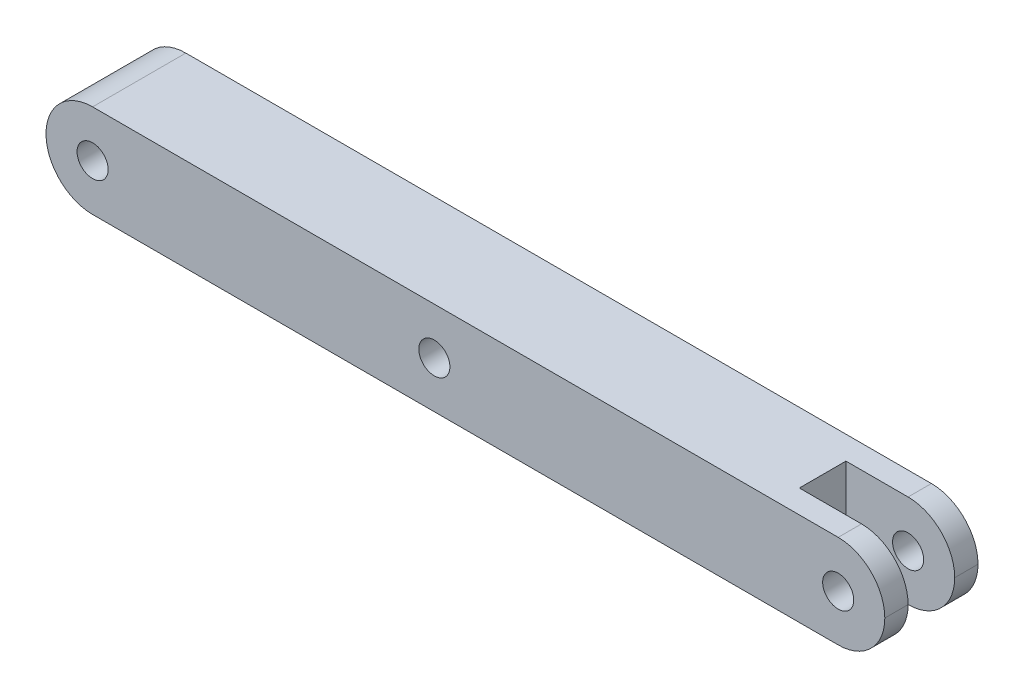
from build123d import *

# Parameters (mm, degrees)
SKETCH1_W               = 270
SKETCH1_H               = 30
BOSS_EXTRUDE1_DEPTH     = 15
CUT_EXTRUDE1_REACH      = 274.075
SKETCH2_W               = 35
SKETCH2_H               = 15
CUT_EXTRUDE2_DEPTH      = 274.313007374
CUT_EXTRUDE2_DEPTH_BACK = 274.313007374
SKETCH3_R               = 5
FILLET3_R               = 15


with BuildPart() as part:
    # Sketch1 → Boss-Extrude1 (new, symmetric)
    with BuildSketch(Plane.XY):
        with Locations((135, 15)):
            Rectangle(SKETCH1_W, SKETCH1_H)
    extrude(amount=BOSS_EXTRUDE1_DEPTH, both=True)

    # Sketch2 → Cut-Extrude1 (cut, up to next)
    with BuildSketch(Plane(origin=(0, 30, 0), x_dir=(1, 0, 0), z_dir=(0, 1, 0)), mode=Mode.PRIVATE) as cut_extrude1_sk1:
        with Locations((252.5, 0)):
            Rectangle(SKETCH2_W, SKETCH2_H)
    cut_extrude1_tool1 = extrude(cut_extrude1_sk1.sketch, amount=-CUT_EXTRUDE1_REACH, mode=Mode.PRIVATE) & part.part
    add(cut_extrude1_tool1.solids().sort_by_distance((252.5, 30, 0))[0], mode=Mode.SUBTRACT)

    # Sketch3 → Cut-Extrude2 (cut, two sides: drawn at the far end of the back side and taken through both)
    with BuildSketch(Plane.XY.offset(15).offset(-CUT_EXTRUDE2_DEPTH_BACK)):
        with Locations((15, 15)):
            Circle(SKETCH3_R)
        with Locations((255, 15)):
            Circle(SKETCH3_R)
        with Locations((125, 15)):
            Circle(SKETCH3_R)
    extrude(amount=CUT_EXTRUDE2_DEPTH + CUT_EXTRUDE2_DEPTH_BACK, mode=Mode.SUBTRACT)

    # Fillet3
    fillet3_edges = [part.edges().sort_by_distance(p)[0] for p in [
        (270, 0, -11.25),
        (270, 30, -11.25),
        (270, 0, 11.25),
        (270, 30, 11.25),
        (0, 0, 0),
        (0, 30, 0),
    ]]
    fillet(fillet3_edges, radius=FILLET3_R - 0.0001)  # a hair under: the kernel refuses the full size


solid = part.part
